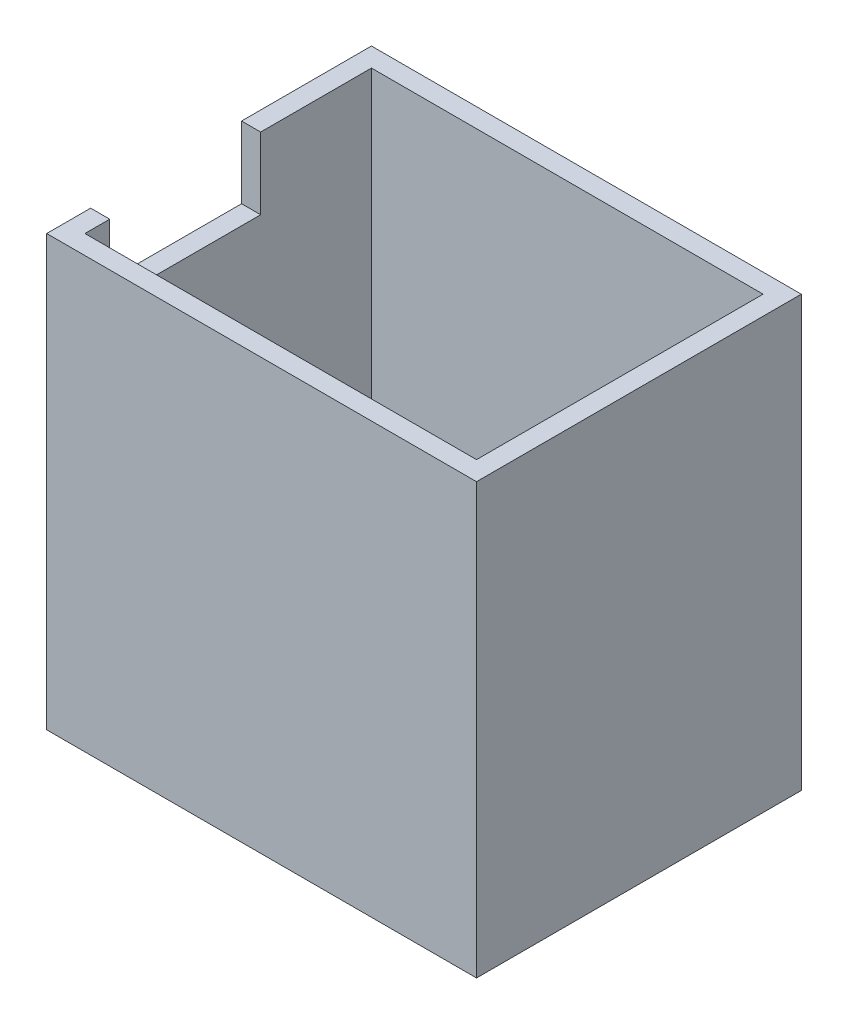
from build123d import *

# Parameters (mm, degrees)
SKETCH1_W                                      = 57.15
SKETCH1_H                                      = 43.18
BASE_DEPTH                                     = 57.15
SKETCH2_W                                      = 52.07
SKETCH2_H                                      = 38.1
POCKET_DEPTH                                   = 47.9552
SKETCH3_W                                      = 18.288
SKETCH3_H                                      = 15.494
LINACTHOLE_DEPTH                               = 68.44465305
ROLLMOTORHOLE_REACH                            = 85.656
SKETCH4_W                                      = 20.066
SKETCH4_H                                      = 9.525
DVIHOLE_REACH                                  = 69.445
CBORE_FOR_4_SOCKET_HEAD_CAP_SCREW1_D           = 3.2639
CBORE_FOR_4_SOCKET_HEAD_CAP_SCREW1_CBORE_D     = 5.55752
CBORE_FOR_4_SOCKET_HEAD_CAP_SCREW1_CBORE_DEPTH = 2.8448
CBORE_FOR_8_SOCKET_HEAD_CAP_SCREW1_D           = 4.4958
CBORE_FOR_8_SOCKET_HEAD_CAP_SCREW1_CBORE_D     = 7.9375
CBORE_FOR_8_SOCKET_HEAD_CAP_SCREW1_CBORE_DEPTH = 4.1656
FILLET1_R                                      = 0.254


with BuildPart() as part:
    # Sketch1 → Base (new body)
    with BuildSketch(Plane(origin=(0, 0, 0), x_dir=(1, 0, 0), z_dir=(0, 1, 0))):
        Rectangle(SKETCH1_W, SKETCH1_H)
    extrude(amount=BASE_DEPTH)

    # Sketch2 → Pocket (cut)
    with BuildSketch(Plane(origin=(0, 57.15, 0), x_dir=(1, 0, 0), z_dir=(0, 1, 0))):
        Rectangle(SKETCH2_W, SKETCH2_H)
    extrude(amount=-POCKET_DEPTH, mode=Mode.SUBTRACT)

    # Sketch3 → LinActHole (cut, through all)
    with BuildSketch(Plane(origin=(0, 0, 0), x_dir=(-1, 0, 0), z_dir=(0, -1, 0))):
        with Locations((-1.651, 0)):
            Rectangle(SKETCH3_W, SKETCH3_H)
    extrude(amount=-LINACTHOLE_DEPTH, mode=Mode.SUBTRACT)

    # Sketch4 → RollMotorHole (cut, up to next)
    with BuildSketch(Plane.ZY.offset(28.575), mode=Mode.PRIVATE) as rollmotorhole_sk1:
        with Locations((5.715, 52.3875)):
            Rectangle(SKETCH4_W, SKETCH4_H)
    rollmotorhole_tool1 = extrude(rollmotorhole_sk1.sketch, amount=-ROLLMOTORHOLE_REACH, mode=Mode.PRIVATE) & part.part
    add(rollmotorhole_tool1.solids().sort_by_distance((-28.575, 52.3875, 5.715))[0], mode=Mode.SUBTRACT)

    # Sketch5 → DviHole (cut, up to next)
    with BuildSketch(Plane.XZ, mode=Mode.PRIVATE) as dvihole_sk1:
        with BuildLine():
            Line((17.624947543, -13.716), (24.228947543, -13.716))
            Line((24.228947543, -13.716), (24.228947543, 13.716))
            Line((24.228947543, 13.716), (17.624947543, 13.716))
            ThreePointArc((17.624947543, 13.716), (15.828896319, 12.972051224), (15.084947543, 11.176))
            Line((15.084947543, 11.176), (15.084947543, -11.176))
            ThreePointArc((15.084947543, -11.176), (15.828896319, -12.972051224), (17.624947543, -13.716))
        make_face()
    dvihole_tool1 = extrude(dvihole_sk1.sketch, amount=-DVIHOLE_REACH, mode=Mode.PRIVATE) & part.part
    add(dvihole_tool1.solids().sort_by_distance((19.701649, 0, 0))[0], mode=Mode.SUBTRACT)

    # CBORE for #4 Socket Head Cap Screw1 (through all)
    with Locations(Plane(origin=(0, 0, 0), x_dir=(-1, 0, 0), z_dir=(0, -1, 0))):
        with Locations((-19.656947543, 16.256), (-19.656947543, -16.256)):
            CounterBoreHole(CBORE_FOR_4_SOCKET_HEAD_CAP_SCREW1_D / 2, CBORE_FOR_4_SOCKET_HEAD_CAP_SCREW1_CBORE_D / 2, CBORE_FOR_4_SOCKET_HEAD_CAP_SCREW1_CBORE_DEPTH)

    # CBORE for #8 Socket Head Cap Screw1 (through all)
    with Locations(Plane(origin=(0, 0, 0), x_dir=(-1, 0, 0), z_dir=(0, -1, 0))):
        with Locations((3.175, 14.605), (3.175, -14.605)):
            CounterBoreHole(CBORE_FOR_8_SOCKET_HEAD_CAP_SCREW1_D / 2, CBORE_FOR_8_SOCKET_HEAD_CAP_SCREW1_CBORE_D / 2, CBORE_FOR_8_SOCKET_HEAD_CAP_SCREW1_CBORE_DEPTH)

    # Fillet1
    fillet1_edges = [part.edges().sort_by_distance(p)[0] for p in [
        (20.783849108, 1.4224, -13.716),
        (18.530045978, 1.4224, -13.716),
        (20.783849108, 1.4224, 13.716),
        (18.530045978, 1.4224, 13.716),
    ]]
    fillet(fillet1_edges, radius=FILLET1_R)


solid = part.part
